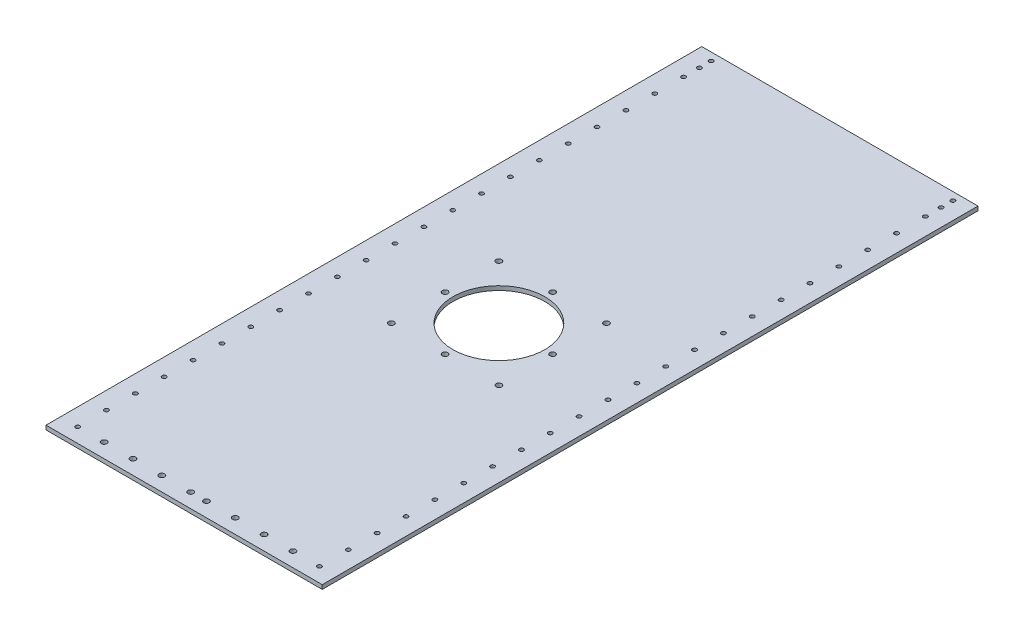
from build123d import *

# Parameters (mm, degrees)
SKETCH1_W           = 210.61
SKETCH1_H           = 500
SKETCH1_R           = 1.6
SKETCH1_R_2         = 2.125
SKETCH1_R_3         = 35
BOSS_EXTRUDE1_DEPTH = 3.175


with BuildPart() as part:
    # Sketch1 → Boss-Extrude1 (new body)
    with BuildSketch(Plane(origin=(0, 0, 0), x_dir=(1, 0, 0), z_dir=(0, 1, 0))):
        Rectangle(SKETCH1_W, SKETCH1_H)
        with Locations((92.18, 244)):
            Circle(SKETCH1_R, mode=Mode.SUBTRACT)
        with Locations((92.18, 235)):
            Circle(SKETCH1_R, mode=Mode.SUBTRACT)
        with Locations((92.18, 223)):
            Circle(SKETCH1_R, mode=Mode.SUBTRACT)
        with Locations((92.18, 201)):
            Circle(SKETCH1_R, mode=Mode.SUBTRACT)
        with Locations((92.18, 179)):
            Circle(SKETCH1_R, mode=Mode.SUBTRACT)
        with Locations((92.18, 157)):
            Circle(SKETCH1_R, mode=Mode.SUBTRACT)
        with Locations((92.18, 135)):
            Circle(SKETCH1_R, mode=Mode.SUBTRACT)
        with Locations((92.18, 113)):
            Circle(SKETCH1_R, mode=Mode.SUBTRACT)
        with Locations((92.18, 91)):
            Circle(SKETCH1_R, mode=Mode.SUBTRACT)
        with Locations((92.18, 69)):
            Circle(SKETCH1_R, mode=Mode.SUBTRACT)
        with Locations((92.18, 47)):
            Circle(SKETCH1_R, mode=Mode.SUBTRACT)
        with Locations((92.18, 25)):
            Circle(SKETCH1_R, mode=Mode.SUBTRACT)
        with Locations((92.18, 3)):
            Circle(SKETCH1_R, mode=Mode.SUBTRACT)
        with Locations((92.18, -19)):
            Circle(SKETCH1_R, mode=Mode.SUBTRACT)
        with Locations((92.18, -41)):
            Circle(SKETCH1_R, mode=Mode.SUBTRACT)
        with Locations((92.18, -63)):
            Circle(SKETCH1_R, mode=Mode.SUBTRACT)
        with Locations((92.18, -85)):
            Circle(SKETCH1_R, mode=Mode.SUBTRACT)
        with Locations((92.18, -107)):
            Circle(SKETCH1_R, mode=Mode.SUBTRACT)
        with Locations((92.18, -129)):
            Circle(SKETCH1_R, mode=Mode.SUBTRACT)
        with Locations((92.18, -151)):
            Circle(SKETCH1_R, mode=Mode.SUBTRACT)
        with Locations((92.18, -173)):
            Circle(SKETCH1_R, mode=Mode.SUBTRACT)
        with Locations((92.18, -195)):
            Circle(SKETCH1_R, mode=Mode.SUBTRACT)
        with Locations((92.18, -217)):
            Circle(SKETCH1_R, mode=Mode.SUBTRACT)
        with Locations((92.18, -239)):
            Circle(SKETCH1_R, mode=Mode.SUBTRACT)
        with Locations((-92.18, 69)):
            Circle(SKETCH1_R, mode=Mode.SUBTRACT)
        with Locations((-92.18, 91)):
            Circle(SKETCH1_R, mode=Mode.SUBTRACT)
        with Locations((-92.18, 113)):
            Circle(SKETCH1_R, mode=Mode.SUBTRACT)
        with Locations((-92.18, 135)):
            Circle(SKETCH1_R, mode=Mode.SUBTRACT)
        with Locations((-92.18, 157)):
            Circle(SKETCH1_R, mode=Mode.SUBTRACT)
        with Locations((-92.18, 179)):
            Circle(SKETCH1_R, mode=Mode.SUBTRACT)
        with Locations((-92.18, 201)):
            Circle(SKETCH1_R, mode=Mode.SUBTRACT)
        with Locations((-92.18, 223)):
            Circle(SKETCH1_R, mode=Mode.SUBTRACT)
        with Locations((-92.18, 235)):
            Circle(SKETCH1_R, mode=Mode.SUBTRACT)
        with Locations((-92.18, -239)):
            Circle(SKETCH1_R, mode=Mode.SUBTRACT)
        with Locations((-92.18, -217)):
            Circle(SKETCH1_R, mode=Mode.SUBTRACT)
        with Locations((-92.18, -195)):
            Circle(SKETCH1_R, mode=Mode.SUBTRACT)
        with Locations((-92.18, -173)):
            Circle(SKETCH1_R, mode=Mode.SUBTRACT)
        with Locations((-92.18, -151)):
            Circle(SKETCH1_R, mode=Mode.SUBTRACT)
        with Locations((-92.18, -129)):
            Circle(SKETCH1_R, mode=Mode.SUBTRACT)
        with Locations((-92.18, -107)):
            Circle(SKETCH1_R, mode=Mode.SUBTRACT)
        with Locations((-92.18, -85)):
            Circle(SKETCH1_R, mode=Mode.SUBTRACT)
        with Locations((-92.18, -63)):
            Circle(SKETCH1_R, mode=Mode.SUBTRACT)
        with Locations((-92.18, -41)):
            Circle(SKETCH1_R, mode=Mode.SUBTRACT)
        with Locations((-92.18, -19)):
            Circle(SKETCH1_R, mode=Mode.SUBTRACT)
        with Locations((-92.18, 3)):
            Circle(SKETCH1_R, mode=Mode.SUBTRACT)
        with Locations((-92.18, 25)):
            Circle(SKETCH1_R, mode=Mode.SUBTRACT)
        with Locations((-92.18, 47)):
            Circle(SKETCH1_R, mode=Mode.SUBTRACT)
        with Locations((-92.18, 244)):
            Circle(SKETCH1_R, mode=Mode.SUBTRACT)
        with Locations((6, -239)):
            Circle(SKETCH1_R_2, mode=Mode.SUBTRACT)
        with Locations((28, -239)):
            Circle(SKETCH1_R_2, mode=Mode.SUBTRACT)
        with Locations((50, -239)):
            Circle(SKETCH1_R_2, mode=Mode.SUBTRACT)
        with Locations((72, -239)):
            Circle(SKETCH1_R_2, mode=Mode.SUBTRACT)
        with Locations((-72, -239)):
            Circle(SKETCH1_R_2, mode=Mode.SUBTRACT)
        with Locations((-50, -239)):
            Circle(SKETCH1_R_2, mode=Mode.SUBTRACT)
        with Locations((-28, -239)):
            Circle(SKETCH1_R_2, mode=Mode.SUBTRACT)
        with Locations((-6, -239)):
            Circle(SKETCH1_R_2, mode=Mode.SUBTRACT)
        with Locations((0, -10)):
            Circle(SKETCH1_R_3, mode=Mode.SUBTRACT)
        with Locations((41, -10)):
            Circle(SKETCH1_R_2, mode=Mode.SUBTRACT)
        with Locations((0, 31)):
            Circle(SKETCH1_R_2, mode=Mode.SUBTRACT)
        with Locations((41, 31)):
            Circle(SKETCH1_R_2, mode=Mode.SUBTRACT)
        with Locations((-41, -10)):
            Circle(SKETCH1_R_2, mode=Mode.SUBTRACT)
        with Locations((-41, 31)):
            Circle(SKETCH1_R_2, mode=Mode.SUBTRACT)
        with Locations((41, -51)):
            Circle(SKETCH1_R_2, mode=Mode.SUBTRACT)
        with Locations((0, -51)):
            Circle(SKETCH1_R_2, mode=Mode.SUBTRACT)
        with Locations((-41, -51)):
            Circle(SKETCH1_R_2, mode=Mode.SUBTRACT)
    extrude(amount=BOSS_EXTRUDE1_DEPTH)


solid = part.part
